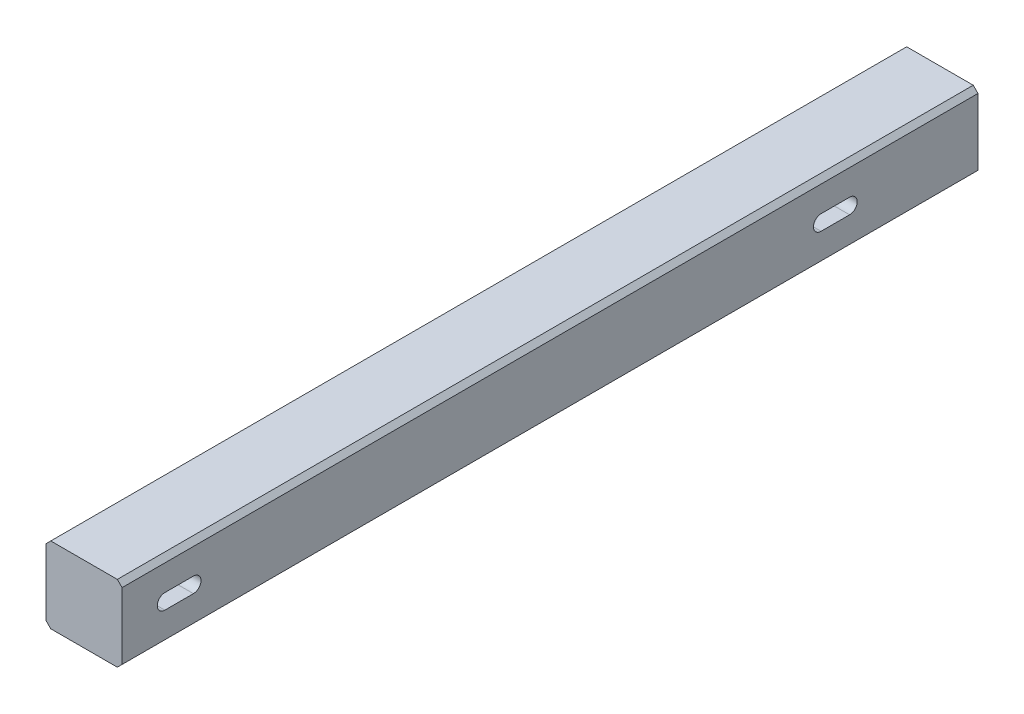
from build123d import *

# Parameters (mm, degrees)
ESQUISSE1_W             = 80
ESQUISSE1_H             = 80
BOSS_EXTRU_1_DEPTH      = 900
ENL_V_MAT_EXTRU_1_DEPTH = 30
ENL_V_MAT_EXTRU_2_DEPTH = 30
CHANFREIN1_SIZE         = 5
ESQUISSE5_R             = 5
ENL_V_MAT_EXTRU_5_DEPTH = 20


with BuildPart() as part:
    # Esquisse1 → Boss.-Extru.1 (new body)
    with BuildSketch(Plane.XY):
        with Locations((40, 40)):
            Rectangle(ESQUISSE1_W, ESQUISSE1_H)
    extrude(amount=BOSS_EXTRU_1_DEPTH)

    # Esquisse2 → Enlèv. mat.-Extru.1 (cut)
    with BuildSketch(Plane.XZ):
        with BuildLine():
            Line((48, 165), (48, 135))
            ThreePointArc((48, 135), (40, 127), (32, 135))
            Line((32, 135), (32, 165))
            ThreePointArc((32, 165), (40, 173), (48, 165))
        make_face()
        with BuildLine():
            Line((32, 825), (32, 855))
            ThreePointArc((32, 855), (40, 863), (48, 855))
            Line((48, 855), (48, 825))
            ThreePointArc((48, 825), (40, 817), (32, 825))
        make_face()
    extrude(amount=-ENL_V_MAT_EXTRU_1_DEPTH, mode=Mode.SUBTRACT)

    # Esquisse3 → Enlèv. mat.-Extru.2 (cut)
    with BuildSketch(Plane(origin=(80, 0, 0), x_dir=(0, 0, -1), z_dir=(1, 0, 0))):
        with BuildLine():
            Line((-165, 48), (-135, 48))
            ThreePointArc((-135, 48), (-127, 40), (-135, 32))
            Line((-135, 32), (-165, 32))
            ThreePointArc((-165, 32), (-173, 40), (-165, 48))
        make_face()
        with BuildLine():
            Line((-855, 48), (-825, 48))
            ThreePointArc((-825, 48), (-817, 40), (-825, 32))
            Line((-825, 32), (-855, 32))
            ThreePointArc((-855, 32), (-863, 40), (-855, 48))
        make_face()
    extrude(amount=-ENL_V_MAT_EXTRU_2_DEPTH, mode=Mode.SUBTRACT)

    # Chanfrein1
    chanfrein1_edges = [part.edges().sort_by_distance(p)[0] for p in [
        (0, 80, 450),
        (80, 80, 450),
        (80, 0, 450),
        (0, 0, 450),
    ]]
    chamfer(chanfrein1_edges, length=CHANFREIN1_SIZE)

    # Esquisse5 → Enlèv. mat.-Extru.5 (cut)
    with BuildSketch(Plane.XZ):
        with Locations((60, 520)):
            Circle(ESQUISSE5_R)
    extrude(amount=-ENL_V_MAT_EXTRU_5_DEPTH, mode=Mode.SUBTRACT)


solid = part.part
